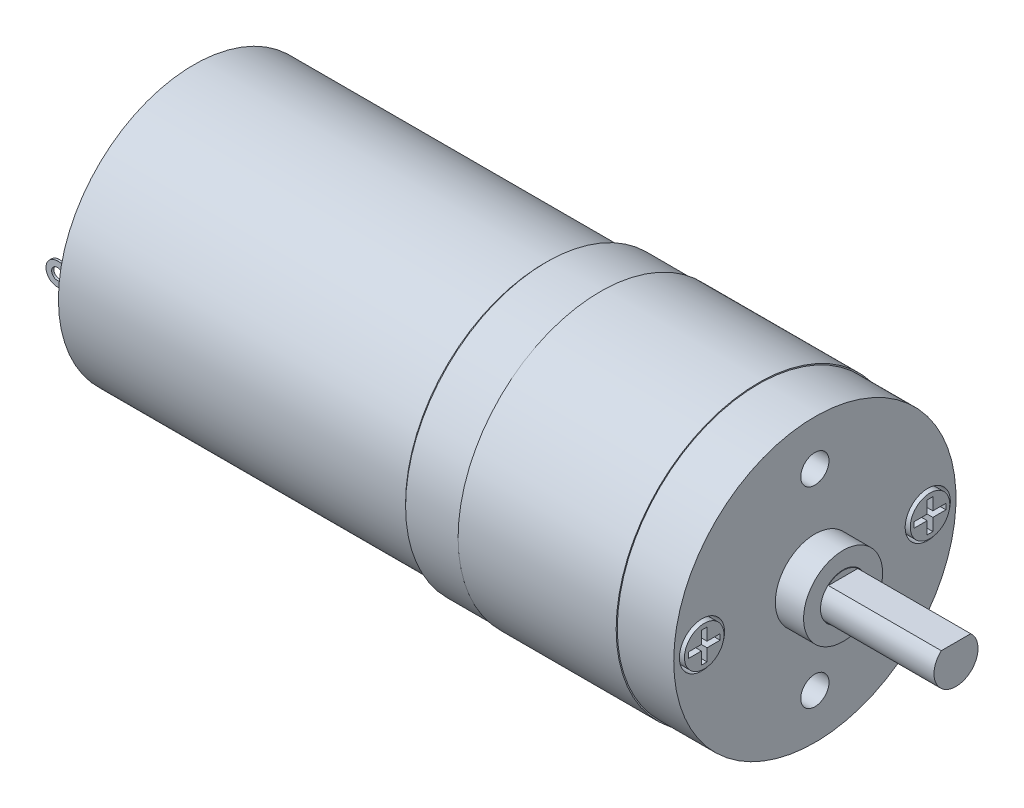
from build123d import *

# Parameters (mm, degrees)
SKETCH3_R               = 3.5
SKETCH3_R_2             = 2
BOSS_EXTRUDE1_DEPTH     = 2.5
SKETCH4_R               = 1.95
BOSS_EXTRUDE2_DEPTH     = 12.5
CUT_EXTRUDE1_DEPTH      = 10
CHAMFER1_SIZE           = 0.25
SKETCH6_R               = 2
CUT_EXTRUDE2_DEPTH      = 5
SKETCH7_R               = 1.75
BOSS_EXTRUDE3_DEPTH     = 5.2
CUT_EXTRUDE4_DEPTH      = 1
SKETCH9_R               = 1.25
CUT_EXTRUDE5_DEPTH      = 5
SKETCH11_W              = 0.2
SKETCH11_H              = 2
BOSS_EXTRUDE4_DEPTH     = 3
CUT_EXTRUDE6_START      = -20.2
CUT_EXTRUDE6_DEPTH      = 20.2
CUT_EXTRUDE7_DEPTH      = 62.520823074
CUT_EXTRUDE7_DEPTH_BACK = 62.520823074
SKETCH13_R              = 0.5


# Read off the part's stored shape, not the designer's step: Cut-Extrude6
with BuildPart() as part:
    # Sketch1 → Revolve1 (revolve)
    with BuildSketch(Plane.XY, mode=Mode.PRIVATE) as revolve1_sk:
        Polygon((-11.725797436, 0), (-11.725797436, 12), (19.274202564, 12), (19.274202564, 12.5), (24.274202564, 12.5), (24.274202564, 12.6), (38.274202564, 12.6), (38.274202564, 12.5), (43.274202564, 12.5), (43.274202564, 0), align=None)
    revolve(revolve1_sk.sketch.rotate(Axis((-11.725797436, 0, 0), (1, 0, 0)), 90), axis=Axis((-11.725797436, 0, 0), (1, 0, 0)))

    # Sketch3 → Boss-Extrude1 (add)
    with BuildSketch(Plane(origin=(43.274202564, 0, 0), x_dir=(0, 0, -1), z_dir=(1, 0, 0))):
        with Locations(Location((0, 0, 0), (0, 0, 180))):
            Circle(SKETCH3_R)
        Circle(SKETCH3_R_2, mode=Mode.SUBTRACT)
    extrude(amount=BOSS_EXTRUDE1_DEPTH)

    # Sketch4 → Boss-Extrude2 (add)
    with BuildSketch(Plane(origin=(43.274202564, 0, 0), x_dir=(0, 0, -1), z_dir=(1, 0, 0))):
        with Locations(Location((0, 0, 0), (0, 0, 180))):
            Circle(SKETCH4_R)
    extrude(amount=BOSS_EXTRUDE2_DEPTH)

    # Sketch5 → Cut-Extrude1 (cut)
    with BuildSketch(Plane(origin=(55.774202564, 0, 0), x_dir=(0, 0, -1), z_dir=(1, 0, 0))):
        with BuildLine():
            Line((0, 1.45), (1.563854219, 1.45))
            ThreePointArc((1.563854219, 1.45), (0.020575485, 2.299790468), (-1.52270325, 1.45))
            Line((-1.52270325, 1.45), (0, 1.45))
        make_face()
    extrude(amount=-CUT_EXTRUDE1_DEPTH, mode=Mode.SUBTRACT)

    # Chamfer1
    chamfer1_edges = [part.edges().sort_by_distance(p)[0] for p in [
        (19.274202564, 0, -12.5),
    ]]
    chamfer(chamfer1_edges, length=CHAMFER1_SIZE)

    # Sketch6 → Cut-Extrude2 (cut)
    with BuildSketch(Plane(origin=(43.274202564, 0, 0), x_dir=(0, 0, -1), z_dir=(1, 0, 0))):
        with Locations((10, 0)):
            Circle(SKETCH6_R)
        with Locations(Location((-10, 0, 0), (0, 0, 180))):
            Circle(SKETCH6_R)
    extrude(amount=-CUT_EXTRUDE2_DEPTH, mode=Mode.SUBTRACT)

    # Sketch7 → Boss-Extrude3 (add)
    with BuildSketch(Plane(origin=(38.274202564, 0, 0), x_dir=(0, 0, -1), z_dir=(1, 0, 0))):
        with Locations((10, 0)):
            Circle(SKETCH7_R)
        with Locations(Location((-10, 0, 0), (0, 0, 180))):
            Circle(SKETCH7_R)
    extrude(amount=BOSS_EXTRUDE3_DEPTH)

    # Sketch8 → Cut-Extrude4 (cut)
    with BuildSketch(Plane(origin=(43.474202564, 0, 0), x_dir=(0, 0, -1), z_dir=(1, 0, 0))):
        Polygon((8.594754122, -0.25), (8.594754122, 0.25), (9.75, 0.25), (9.75, 1.338286548), (10.25, 1.338286548), (10.25, 0.25), (11.405245878, 0.25), (11.405245878, -0.25), (10.25, -0.25), (10.25, -1.338286548), (9.75, -1.338286548), (9.75, -0.25), align=None)
        Polygon((-10.25, -0.25), (-11.405245878, -0.25), (-11.405245878, 0.25), (-10.25, 0.25), (-10.25, 1.338286548), (-9.75, 1.338286548), (-9.75, 0.25), (-8.594754122, 0.25), (-8.594754122, -0.25), (-9.75, -0.25), (-9.75, -1.338286548), (-10.25, -1.338286548), align=None)
    extrude(amount=-CUT_EXTRUDE4_DEPTH, mode=Mode.SUBTRACT)

    # Sketch9 → Cut-Extrude5 (cut)
    with BuildSketch(Plane(origin=(43.274202564, 0, 0), x_dir=(0, 0, -1), z_dir=(1, 0, 0))):
        with Locations((0, 8.5)):
            Circle(SKETCH9_R)
        with Locations(Location((0, -8.5, 0), (0, 0, 180))):
            Circle(SKETCH9_R)
    extrude(amount=-CUT_EXTRUDE5_DEPTH, mode=Mode.SUBTRACT)

    # Sketch11 → Boss-Extrude4 (add)
    with BuildSketch(Plane.ZY.offset(11.725797436)):
        with Locations((10, 0)):
            Rectangle(SKETCH11_W, SKETCH11_H)
        with Locations((-10, 0)):
            Rectangle(SKETCH11_W, SKETCH11_H)
    extrude(amount=BOSS_EXTRUDE4_DEPTH)

    # Cut-Extrude6 outline → Cut-Extrude6 (cut)
    with BuildSketch(Plane(origin=(0, 0, -10.1), x_dir=(-1, 0, 0), z_dir=(0, 0, -1)).offset(CUT_EXTRUDE6_START)):
        with BuildLine():
            ThreePointArc((13.765046185, 1), (14.446690478, 0.693369124), (14.725797436, 0))
            Line((14.725797436, 0), (14.725797436, 1))
            Line((14.725797436, 1), (13.765046185, 1))
        make_face()
        with BuildLine():
            ThreePointArc((14.725797436, 0), (14.446690478, -0.693369124), (13.765046185, -1))
            Line((13.765046185, -1), (14.725797436, -1))
            Line((14.725797436, -1), (14.725797436, 0))
        make_face()
    extrude(amount=CUT_EXTRUDE6_DEPTH, mode=Mode.SUBTRACT)

    # Sketch13 → Cut-Extrude7 (cut, two sides: drawn at the far end of the back side and taken through both)
    with BuildSketch(Plane(origin=(0, 0, -10.1), x_dir=(-1, 0, 0), z_dir=(0, 0, -1)).offset(-CUT_EXTRUDE7_DEPTH_BACK)):
        with Locations((13.724995738, 0)):
            Circle(SKETCH13_R)
    extrude(amount=CUT_EXTRUDE7_DEPTH + CUT_EXTRUDE7_DEPTH_BACK, mode=Mode.SUBTRACT)


solid = part.part
